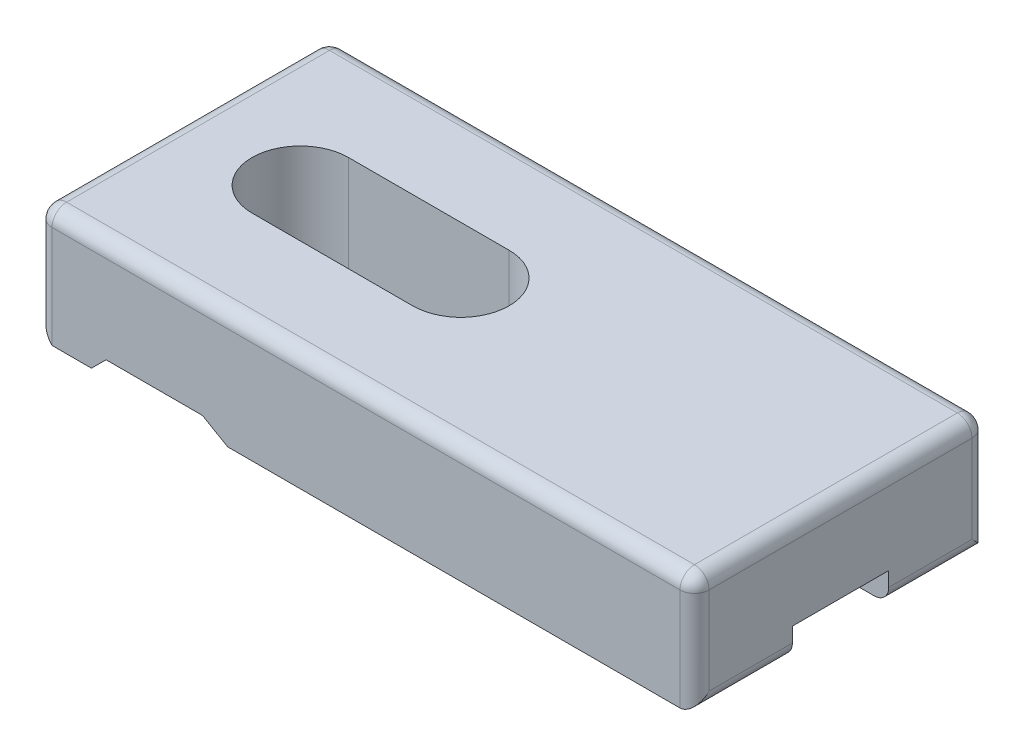
from build123d import *
from OCP.BRepFilletAPI import BRepFilletAPI_MakeChamfer

# Parameters (mm, degrees)
SKETCH_1_W          = 45
SKETCH_1_H          = 20
EXTRUDE_1_DEPTH     = 8
CUT_EXTRUDE_1_DEPTH = 2
CUT_EXTRUDE_2_DEPTH = 1
CHAMFER_1_SIZE      = 1
CHAMFER_2_SIZE      = 1
CHAMFER_2_SIZE_2    = 1.732050808
FILLET_1_R          = 1


with BuildPart() as part:
    # 草图1 → 凸台-拉伸1 (new body)
    with BuildSketch(Plane(origin=(0, 0, 0), x_dir=(1, 0, 0), z_dir=(0, 1, 0))):
        with Locations((22.5, 10)):
            Rectangle(SKETCH_1_W, SKETCH_1_H)
        with BuildLine():
            Line((19, 6.7), (8, 6.7))
            ThreePointArc((8, 6.7), (4.7, 10), (8, 13.3))
            Line((8, 13.3), (19, 13.3))
            ThreePointArc((19, 13.3), (22.3, 10), (19, 6.7))
        make_face(mode=Mode.SUBTRACT)
    extrude(amount=EXTRUDE_1_DEPTH)

    # 草图2 → 切除-拉伸1 (cut)
    with BuildSketch(Plane.XZ):
        with BuildLine():
            Line((45, -6.7), (45, -13.3))
            Line((45, -13.3), (8, -13.3))
            ThreePointArc((8, -13.3), (4.7, -10), (8, -6.7))
            Line((8, -6.7), (45, -6.7))
        make_face()
    extrude(amount=-CUT_EXTRUDE_1_DEPTH, mode=Mode.SUBTRACT)

    # 草图3 → 切除-拉伸2 (cut)
    with BuildSketch(Plane.XZ):
        Polygon((0, -6.7), (4.7, -6.7), (4.7, 0), (11.3, 0), (11.3, -20), (4.7, -20), (4.7, -13.3), (0, -13.3), align=None)
    extrude(amount=-CUT_EXTRUDE_2_DEPTH, mode=Mode.SUBTRACT)

    # 倒角1
    chamfer_1_edges = [part.edges().sort_by_distance(p)[0] for p in [
        (0, 0, -16.65),
        (4.7, 0, -16.65),
        (4.7, 0, -3.35),
        (0, 0, -3.35),
    ]]
    chamfer(chamfer_1_edges, length=CHAMFER_1_SIZE - 0.0001)  # a hair under: the kernel refuses the full size

    # 倒角2
    chamfer_2_edges_1 = [part.edges().sort_by_distance(p)[0] for p in [
        (11.3, 0, -16.65),
    ]]
    chamfer_2_side_1 = [part.faces().sort_by_distance(p)[0] for p in [
        (11.3, 0.02, -16.65),
    ]]
    chamfer_2_edges_2 = [part.edges().sort_by_distance(p)[0] for p in [
        (11.3, 0, -3.35),
    ]]
    chamfer_2_side_2 = [part.faces().sort_by_distance(p)[0] for p in [
        (11.3, 0.02, -3.35),
    ]]
    chamfer_2 = BRepFilletAPI_MakeChamfer(part.part.solid().wrapped)
    for e in chamfer_2_edges_1:
        chamfer_2.Add(CHAMFER_2_SIZE - 0.0001, CHAMFER_2_SIZE_2 - 0.0001, e.wrapped, chamfer_2_side_1[0].wrapped)
    for e in chamfer_2_edges_2:
        chamfer_2.Add(CHAMFER_2_SIZE - 0.0001, CHAMFER_2_SIZE_2 - 0.0001, e.wrapped, chamfer_2_side_2[0].wrapped)
    add(Compound.cast(chamfer_2.Shape()), mode=Mode.REPLACE)  # a hair under: the kernel refuses the full size

    # 圆角1
    fillet_1_edges = [part.edges().sort_by_distance(p)[0] for p in [
        (22.5, 8, -20),
        (45, 8, -10),
        (22.5, 8, 0),
        (0, 8, -10),
        (45, 4, 0),
        (45, 4, -20),
        (0, 4.49995, -20),
        (0, 4.49995, 0),
        (45, 0, -16.65),
        (45, 0, -3.35),
    ]]
    fillet(fillet_1_edges, radius=FILLET_1_R)


solid = part.part
